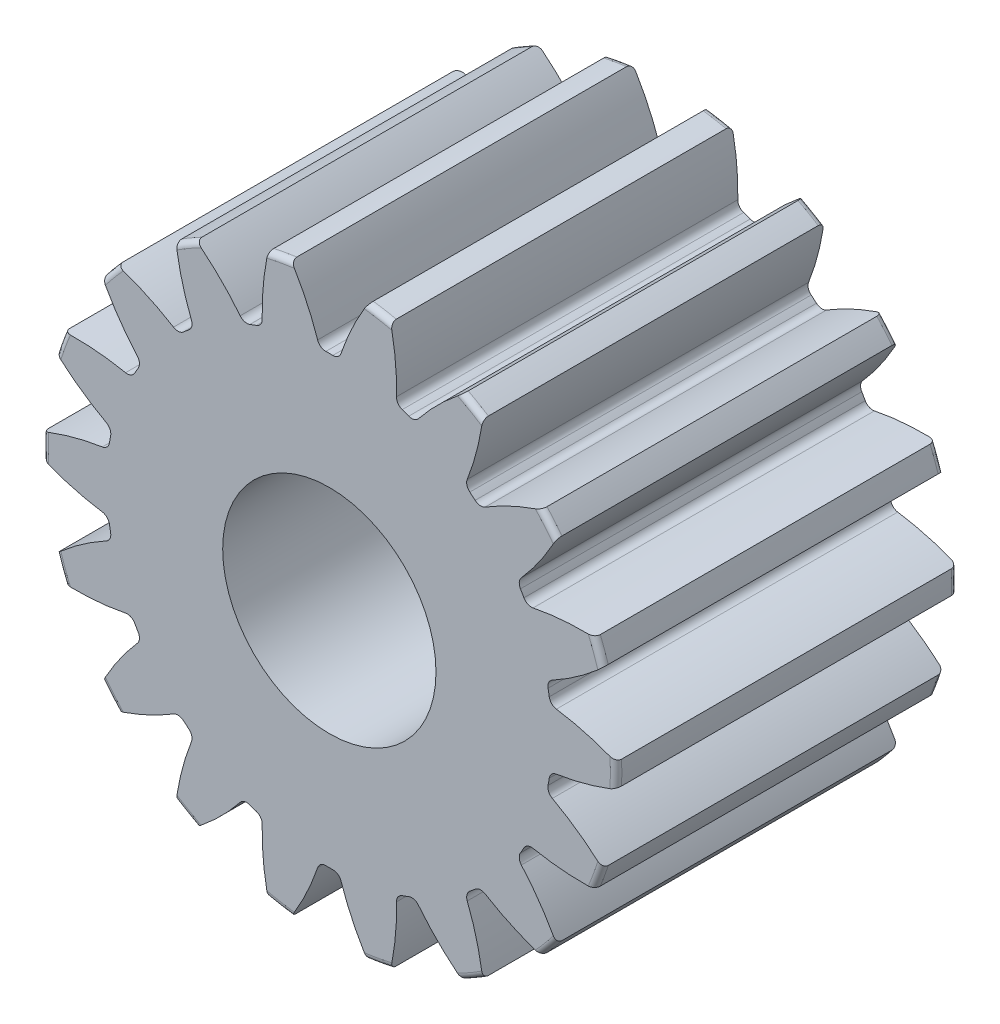
from build123d import *

# Parameters (mm, degrees)
FILLET2_R               = 0.10668
CUT_EXTRUDE2_DEPTH      = 10.860304972
CIRPATTERN1_COUNT       = 18
CUT_EXTRUDE3_DEPTH      = 13.129377689
CUT_EXTRUDE3_DEPTH_BACK = 13.129377689
SKETCH8_W               = 8.16356
SKETCH8_H               = 3.175


with BuildPart() as part:
    # Sketch4 → Revolve1 (revolve)
    with BuildSketch(Plane(origin=(0, 0, 0), x_dir=(0, 0, -1), z_dir=(1, 0, 0))):
        Polygon((-9.525, 1.984375), (-9.525, 3.9751), (-6.35, 3.9751), (-6.35, 5.334), (0, 5.334), (0, 1.984375), align=None)
    revolve(axis=Axis((0, 0, 3.175), (0, 0, 1)))

    # Fillet2
    fillet2_edges = [part.edges().sort_by_distance(p)[0] for p in [
        (0, -3.9751, 9.525),
        (0, -3.9751, 6.35),
        (0, -5.334, 6.35),
        (0, -5.334, 0),
    ]]
    fillet(fillet2_edges, radius=FILLET2_R)

    # Sketch7 → Cut-Extrude2 (cut, through all)
    with BuildSketch(Plane.XY.offset(6.35)):
        with BuildLine():
            ThreePointArc((-0.064763188, 4.142868827), (0, 4.143375), (0.064763188, 4.142868827))
            ThreePointArc((0.064763188, 4.142868827), (0.158874403, 4.171960564), (0.217710969, 4.250963782))
            ThreePointArc((0.217710969, 4.250963782), (0.433564361, 4.783553385), (0.711994388, 5.286267113))
            ThreePointArc((0.711994388, 5.286267113), (0, 5.334), (-0.711994388, 5.286267113))
            ThreePointArc((-0.711994388, 5.286267113), (-0.433564361, 4.783553385), (-0.217710969, 4.250963782))
            ThreePointArc((-0.217710969, 4.250963782), (-0.158874403, 4.171960564), (-0.064763188, 4.142868827))
        make_face()
    cut_extrude2 = extrude(amount=-CUT_EXTRUDE2_DEPTH, mode=Mode.SUBTRACT)

    # CirPattern1: Cut-Extrude2 ×18 about axis
    cirpattern1_axis = Axis((0, 0, 9.525), (0, 0, -1))
    for i in range(1, CIRPATTERN1_COUNT):
        add(cut_extrude2.rotate(cirpattern1_axis, i * 360 / CIRPATTERN1_COUNT), mode=Mode.SUBTRACT)

    # Sketch8 → Cut-Extrude3 (cut, two sides: drawn at the far end of the back side and taken through both)
    with BuildSketch(Plane(origin=(0, 0, 0), x_dir=(1, 0, 0), z_dir=(0, 1, 0)).offset(-CUT_EXTRUDE3_DEPTH_BACK)):
        with Locations((0, -7.9375)):
            Rectangle(SKETCH8_W, SKETCH8_H)
    extrude(amount=CUT_EXTRUDE3_DEPTH + CUT_EXTRUDE3_DEPTH_BACK, mode=Mode.SUBTRACT)


solid = part.part
